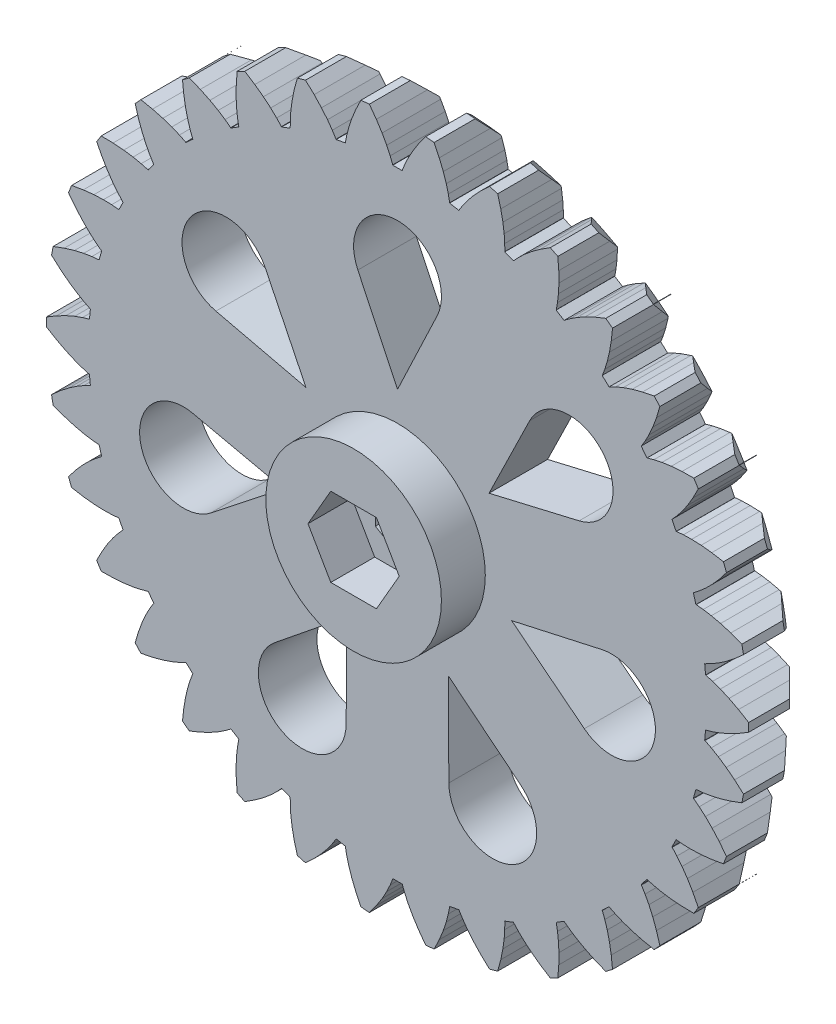
from build123d import *
from OCP.BRepAlgoAPI import BRepAlgoAPI_Cut
from OCP.TopTools import TopTools_ListOfShape

# Parameters (mm, degrees)
BOSS_EXTRUDE1_DEPTH = 4
SKETCH3_R           = 6
BOSS_EXTRUDE2_DEPTH = 3
CUT_EXTRUDE1_DEPTH  = 35.600087977
CUT_EXTRUDE2_DEPTH  = 3
CUT_EXTRUDE3_DEPTH  = 35.119878194
CIRPATTERN1_COUNT   = 7


with BuildPart() as part:
    # Model → Boss-Extrude1 (new body)
    with BuildSketch(Plane.XY):
        Polygon((-23.998, -0.289), (-23.998, 0.289), (-23.301, 0.707), (-22.653, 1.042), (-22.061, 1.301), (-21.531, 1.492), (-21.071, 1.627), (-21.05, 1.625), (-20.99, 2.27), (-21.011, 2.272), (-21.439, 2.49), (-21.924, 2.775), (-22.459, 3.138), (-23.034, 3.587), (-23.642, 4.126), (-23.536, 4.694), (-22.774, 4.977), (-22.076, 5.187), (-21.446, 5.333), (-20.89, 5.423), (-20.413, 5.471), (-20.393, 5.466), (-20.216, 6.089), (-20.236, 6.095), (-20.616, 6.387), (-21.041, 6.756), (-21.5, 7.212), (-21.983, 7.758), (-22.482, 8.4), (-22.273, 8.939), (-21.472, 9.077), (-20.747, 9.155), (-20.101, 9.182), (-19.538, 9.169), (-19.06, 9.129), (-19.042, 9.12), (-18.753, 9.7), (-18.771, 9.709), (-19.091, 10.066), (-19.442, 10.507), (-19.809, 11.039), (-20.183, 11.665), (-20.556, 12.388), (-20.251, 12.879), (-19.439, 12.867), (-18.711, 12.811), (-18.072, 12.72), (-17.521, 12.603), (-17.058, 12.476), (-17.042, 12.464), (-16.652, 12.98), (-16.668, 12.993), (-16.917, 13.403), (-17.18, 13.901), (-17.443, 14.491), (-17.696, 15.175), (-17.929, 15.954), (-17.54, 16.381), (-16.743, 16.22), (-16.039, 16.031), (-15.427, 15.824), (-14.906, 15.608), (-14.476, 15.398), (-14.462, 15.383), (-13.983, 15.82), (-13.996, 15.835), (-14.166, 16.283), (-14.333, 16.821), (-14.483, 17.45), (-14.606, 18.169), (-14.693, 18.977), (-14.231, 19.325), (-13.478, 19.021), (-12.82, 18.705), (-12.257, 18.389), (-11.785, 18.081), (-11.4, 17.796), (-11.389, 17.779), (-10.838, 18.119), (-10.849, 18.137), (-10.933, 18.609), (-10.998, 19.168), (-11.03, 19.814), (-11.019, 20.543), (-10.956, 21.353), (-10.438, 21.611), (-9.753, 21.173), (-9.165, 20.743), (-8.669, 20.328), (-8.262, 19.939), (-7.936, 19.587), (-7.928, 19.568), (-7.324, 19.802), (-7.331, 19.821), (-7.327, 20.301), (-7.289, 20.863), (-7.202, 21.503), (-7.057, 22.218), (-6.845, 23.003), (-6.289, 23.161), (-5.697, 22.605), (-5.197, 22.073), (-4.786, 21.575), (-4.457, 21.117), (-4.201, 20.712), (-4.197, 20.692), (-3.56, 20.81), (-3.564, 20.831), (-3.472, 21.301), (-3.331, 21.847), (-3.128, 22.46), (-2.854, 23.136), (-2.502, 23.869), (-1.926, 23.922), (-1.446, 23.267), (-1.053, 22.653), (-0.74, 22.087), (-0.501, 21.577), (-0.324, 21.131), (-0.324, 21.111), (0.324, 21.11), (0.324, 21.131), (0.501, 21.577), (0.74, 22.087), (1.053, 22.653), (1.446, 23.267), (1.926, 23.922), (2.502, 23.869), (2.854, 23.136), (3.128, 22.46), (3.331, 21.847), (3.472, 21.301), (3.564, 20.831), (3.56, 20.81), (4.197, 20.692), (4.201, 20.712), (4.457, 21.117), (4.786, 21.575), (5.197, 22.073), (5.697, 22.605), (6.289, 23.161), (6.845, 23.003), (7.057, 22.218), (7.202, 21.503), (7.289, 20.863), (7.327, 20.301), (7.331, 19.821), (7.324, 19.802), (7.928, 19.568), (7.936, 19.587), (8.262, 19.939), (8.669, 20.328), (9.165, 20.743), (9.753, 21.173), (10.438, 21.611), (10.956, 21.353), (11.019, 20.543), (11.03, 19.814), (10.998, 19.168), (10.933, 18.609), (10.849, 18.137), (10.838, 18.119), (11.389, 17.778), (11.4, 17.796), (11.785, 18.081), (12.257, 18.389), (12.82, 18.705), (13.478, 19.021), (14.231, 19.325), (14.693, 18.977), (14.606, 18.169), (14.483, 17.45), (14.333, 16.821), (14.166, 16.283), (13.996, 15.835), (13.983, 15.82), (14.462, 15.383), (14.476, 15.398), (14.906, 15.608), (15.427, 15.824), (16.039, 16.031), (16.743, 16.22), (17.54, 16.381), (17.929, 15.954), (17.696, 15.175), (17.443, 14.491), (17.18, 13.901), (16.917, 13.403), (16.668, 12.993), (16.652, 12.981), (17.042, 12.464), (17.058, 12.476), (17.521, 12.603), (18.072, 12.72), (18.711, 12.811), (19.439, 12.867), (20.251, 12.879), (20.556, 12.388), (20.183, 11.665), (19.809, 11.039), (19.442, 10.507), (19.091, 10.066), (18.771, 9.709), (18.753, 9.7), (19.042, 9.12), (19.06, 9.129), (19.538, 9.169), (20.101, 9.182), (20.747, 9.155), (21.472, 9.077), (22.273, 8.939), (22.482, 8.4), (21.983, 7.758), (21.5, 7.212), (21.041, 6.756), (20.616, 6.387), (20.236, 6.095), (20.216, 6.089), (20.393, 5.466), (20.413, 5.471), (20.89, 5.423), (21.446, 5.333), (22.076, 5.187), (22.774, 4.977), (23.536, 4.694), (23.642, 4.126), (23.034, 3.587), (22.459, 3.138), (21.924, 2.775), (21.439, 2.49), (21.011, 2.272), (20.99, 2.27), (21.051, 1.625), (21.071, 1.627), (21.531, 1.492), (22.061, 1.301), (22.653, 1.042), (23.301, 0.707), (23.998, 0.289), (23.998, -0.289), (23.301, -0.707), (22.653, -1.042), (22.061, -1.301), (21.531, -1.492), (21.071, -1.627), (21.05, -1.625), (20.99, -2.27), (21.011, -2.272), (21.439, -2.49), (21.924, -2.775), (22.459, -3.138), (23.034, -3.587), (23.642, -4.126), (23.536, -4.694), (22.774, -4.977), (22.076, -5.187), (21.446, -5.333), (20.89, -5.423), (20.413, -5.471), (20.393, -5.466), (20.216, -6.089), (20.236, -6.095), (20.616, -6.387), (21.041, -6.756), (21.5, -7.212), (21.983, -7.758), (22.482, -8.4), (22.273, -8.939), (21.472, -9.077), (20.747, -9.155), (20.101, -9.182), (19.538, -9.169), (19.06, -9.129), (19.042, -9.12), (18.753, -9.7), (18.771, -9.709), (19.091, -10.066), (19.442, -10.507), (19.809, -11.039), (20.183, -11.665), (20.556, -12.388), (20.251, -12.879), (19.439, -12.867), (18.711, -12.811), (18.072, -12.72), (17.521, -12.603), (17.058, -12.476), (17.042, -12.464), (16.652, -12.98), (16.668, -12.993), (16.917, -13.403), (17.18, -13.901), (17.443, -14.491), (17.696, -15.175), (17.929, -15.954), (17.54, -16.381), (16.743, -16.22), (16.039, -16.031), (15.427, -15.824), (14.906, -15.608), (14.476, -15.398), (14.462, -15.383), (13.983, -15.82), (13.996, -15.835), (14.166, -16.283), (14.333, -16.821), (14.483, -17.45), (14.606, -18.169), (14.693, -18.977), (14.231, -19.325), (13.478, -19.021), (12.82, -18.705), (12.257, -18.389), (11.785, -18.081), (11.4, -17.796), (11.389, -17.779), (10.838, -18.119), (10.849, -18.137), (10.933, -18.609), (10.998, -19.168), (11.03, -19.814), (11.019, -20.543), (10.956, -21.353), (10.438, -21.611), (9.753, -21.173), (9.165, -20.743), (8.669, -20.328), (8.262, -19.939), (7.936, -19.587), (7.928, -19.568), (7.324, -19.802), (7.331, -19.821), (7.327, -20.301), (7.289, -20.863), (7.202, -21.503), (7.057, -22.218), (6.845, -23.003), (6.289, -23.161), (5.697, -22.605), (5.197, -22.073), (4.786, -21.575), (4.457, -21.117), (4.201, -20.712), (4.197, -20.692), (3.56, -20.81), (3.564, -20.831), (3.472, -21.301), (3.331, -21.847), (3.128, -22.46), (2.854, -23.136), (2.502, -23.869), (1.926, -23.922), (1.446, -23.267), (1.053, -22.653), (0.74, -22.087), (0.501, -21.577), (0.324, -21.131), (0.324, -21.111), (-0.324, -21.11), (-0.324, -21.131), (-0.501, -21.577), (-0.74, -22.087), (-1.053, -22.653), (-1.446, -23.267), (-1.926, -23.922), (-2.502, -23.869), (-2.854, -23.136), (-3.128, -22.46), (-3.331, -21.847), (-3.472, -21.301), (-3.564, -20.831), (-3.56, -20.81), (-4.197, -20.692), (-4.201, -20.712), (-4.457, -21.117), (-4.786, -21.575), (-5.197, -22.073), (-5.697, -22.605), (-6.289, -23.161), (-6.845, -23.003), (-7.057, -22.218), (-7.202, -21.503), (-7.289, -20.863), (-7.327, -20.301), (-7.331, -19.821), (-7.324, -19.802), (-7.928, -19.568), (-7.936, -19.587), (-8.262, -19.939), (-8.669, -20.328), (-9.165, -20.743), (-9.753, -21.173), (-10.438, -21.611), (-10.956, -21.353), (-11.019, -20.543), (-11.03, -19.814), (-10.998, -19.168), (-10.933, -18.609), (-10.849, -18.137), (-10.838, -18.119), (-11.389, -17.778), (-11.4, -17.796), (-11.785, -18.081), (-12.257, -18.389), (-12.82, -18.705), (-13.478, -19.021), (-14.231, -19.325), (-14.693, -18.977), (-14.606, -18.169), (-14.483, -17.45), (-14.333, -16.821), (-14.166, -16.283), (-13.996, -15.835), (-13.983, -15.82), (-14.462, -15.383), (-14.476, -15.398), (-14.906, -15.608), (-15.427, -15.824), (-16.039, -16.031), (-16.743, -16.22), (-17.54, -16.381), (-17.929, -15.954), (-17.696, -15.175), (-17.443, -14.491), (-17.18, -13.901), (-16.917, -13.403), (-16.668, -12.993), (-16.652, -12.981), (-17.042, -12.464), (-17.058, -12.476), (-17.521, -12.603), (-18.072, -12.72), (-18.711, -12.811), (-19.439, -12.867), (-20.251, -12.879), (-20.556, -12.388), (-20.183, -11.665), (-19.809, -11.039), (-19.442, -10.507), (-19.091, -10.066), (-18.771, -9.709), (-18.753, -9.7), (-19.042, -9.12), (-19.06, -9.129), (-19.538, -9.169), (-20.101, -9.182), (-20.747, -9.155), (-21.472, -9.077), (-22.273, -8.939), (-22.482, -8.4), (-21.983, -7.758), (-21.5, -7.212), (-21.041, -6.756), (-20.616, -6.387), (-20.236, -6.095), (-20.216, -6.089), (-20.393, -5.466), (-20.413, -5.471), (-20.89, -5.423), (-21.446, -5.333), (-22.076, -5.187), (-22.774, -4.977), (-23.536, -4.694), (-23.642, -4.126), (-23.034, -3.587), (-22.459, -3.138), (-21.924, -2.775), (-21.439, -2.49), (-21.011, -2.272), (-20.99, -2.27), (-21.051, -1.625), (-21.071, -1.627), (-21.531, -1.492), (-22.061, -1.301), (-22.653, -1.042), (-23.301, -0.707), align=None)
    extrude(amount=BOSS_EXTRUDE1_DEPTH)

    # Sketch3 → Boss-Extrude2 (add)
    with BuildSketch(Plane.XY.offset(4)):
        Circle(SKETCH3_R)
    extrude(amount=BOSS_EXTRUDE2_DEPTH)

    # Sketch2 → Cut-Extrude1 (cut, through all)
    with BuildSketch(Plane.XY.offset(7)):
        Polygon((1.491563289, -0.880476549), (1.508296704, 0.851493425), (0.016733414, 1.731969975), (-1.491563289, 0.880476549), (-1.508296704, -0.851493425), (-0.016733414, -1.731969975), align=None)
    extrude(amount=-CUT_EXTRUDE1_DEPTH, mode=Mode.SUBTRACT)

    # Sketch4 → Cut-Extrude2 (cut)
    with BuildSketch(Plane.XY.offset(7)):
        Polygon((3.117691454, 0), (1.558845727, 2.7), (-1.558845727, 2.7), (-3.117691454, 0), (-1.558845727, -2.7), (1.558845727, -2.7), align=None)
    extrude(amount=-CUT_EXTRUDE2_DEPTH, mode=Mode.SUBTRACT)

    # Sketch5 → Cut-Extrude3 (cut, through all)
    with BuildSketch(Plane.XY.offset(4)):
        with BuildLine():
            Line((-2.710523709, 13.714285714), (0, 8))
            Line((0, 8), (2.710523709, 13.714285714))
            ThreePointArc((2.710523709, 13.714285714), (0, 18), (-2.710523709, 13.714285714))
        make_face()
    cut_extrude3 = extrude(amount=-CUT_EXTRUDE3_DEPTH, mode=Mode.SUBTRACT)

    # CirPattern1: Cut-Extrude3 ×7 about axis
    cirpattern1_axis = Axis((0, 0, 7.35), (0, 0, -1))
    for i in range(1, CIRPATTERN1_COUNT):
        add(cut_extrude3.rotate(cirpattern1_axis, i * 360 / CIRPATTERN1_COUNT), mode=Mode.SUBTRACT)


with BuildPart() as cut_revolve1_tool:
    # Sketch6 → Cut-Revolve1 (revolve)
    with BuildSketch(Plane(origin=(0, 0, 0), x_dir=(1, 0, 0), z_dir=(0, 1, 0))):
        Polygon((24, 0), (22.8, 0), (24, -1.2), align=None)
    revolve(axis=Axis((0, 0, 7.35), (0, 0, -1)))


with BuildPart() as part_1:
    add(part.part)

    # Cut-Revolve1: cut by cut_revolve1_tool, with a tolerance
    cut_revolve1_stock = TopTools_ListOfShape()
    cut_revolve1_stock.Append(part_1.part.wrapped)
    cut_revolve1_tools = TopTools_ListOfShape()
    cut_revolve1_tools.Append(cut_revolve1_tool.part.wrapped)
    cut_revolve1_cut = BRepAlgoAPI_Cut()
    cut_revolve1_cut.SetArguments(cut_revolve1_stock)
    cut_revolve1_cut.SetTools(cut_revolve1_tools)
    cut_revolve1_cut.SetFuzzyValue(0.00001)
    cut_revolve1_cut.Build()
    add(Compound.cast(cut_revolve1_cut.Shape()).solids(), mode=Mode.REPLACE)


solid = part_1.part
